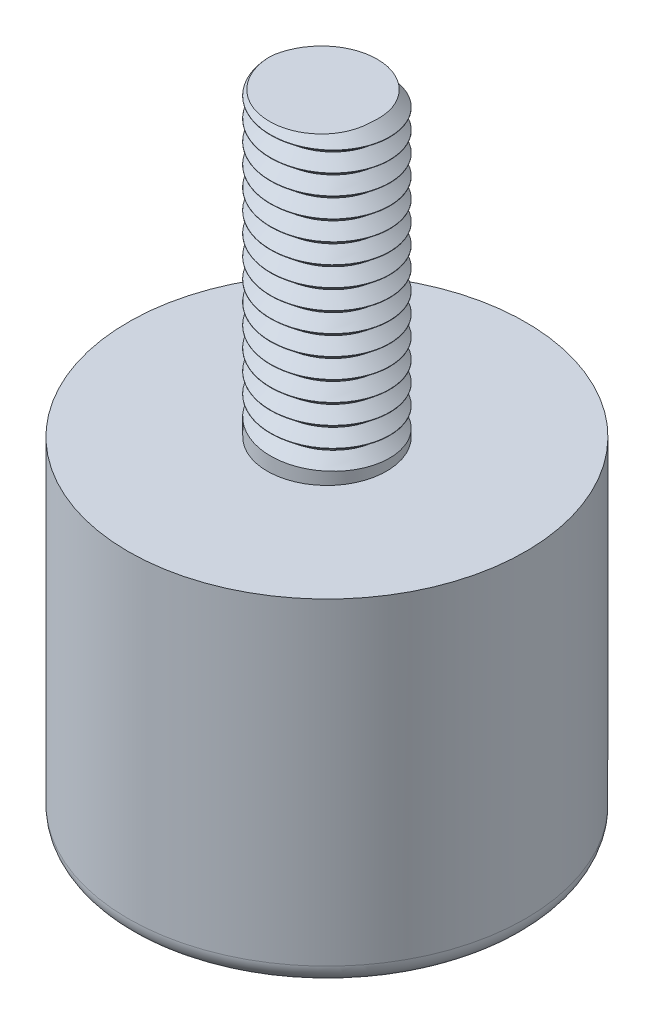
from build123d import *
from build123d.topology import SkipClean

# Parameters (mm, degrees)
ESQUISSE1_R                           = 10
BOSS_EXTRU_1_DEPTH                    = 2
ESQUISSE2_R                           = 10
ESQUISSE2_R_2                         = 8
BOSS_EXTRU_2_DEPTH                    = 15
CONG_1_R                              = 1
ESQUISSE3_R                           = 3
BOSS_EXTRU_3_DEPTH                    = 15
ENL_VEMENT_DE_MATI_RE_BALAYAGE1_PITCH = 1


with BuildPart() as part:
    # Esquisse1 → Boss.-Extru.1 (new body)
    with BuildSketch(Plane(origin=(0, 0, 0), x_dir=(1, 0, 0), z_dir=(0, 1, 0))):
        with Locations(Location((0, 0, 0), (0, 0, 270))):
            Circle(ESQUISSE1_R)
    extrude(amount=-BOSS_EXTRU_1_DEPTH)

    # Esquisse2 → Boss.-Extru.2 (add)
    with BuildSketch(Plane(origin=(0, -2, 0), x_dir=(-1, 0, 0), z_dir=(0, -1, 0))):
        with Locations(Location((0, 0, 0), (0, 0, 270))):
            Circle(ESQUISSE2_R)
        with Locations(Location((0, 0, 0), (0, 0, 90))):
            Circle(ESQUISSE2_R_2, mode=Mode.SUBTRACT)
    extrude(amount=BOSS_EXTRU_2_DEPTH)

    # Congé1
    cong_1_edges = [part.edges().sort_by_distance(p)[0] for p in [
        (0, -17, -10),
    ]]
    fillet(cong_1_edges, radius=CONG_1_R)

    # Esquisse3 → Boss.-Extru.3 (add)
    with BuildSketch(Plane(origin=(0, 0, 0), x_dir=(1, 0, 0), z_dir=(0, 1, 0))):
        with Locations(Location((0, 0, 0), (0, 0, 270))):
            Circle(ESQUISSE3_R)
    extrude(amount=BOSS_EXTRU_3_DEPTH)

    # Enlèvement de matière-Balayage1: the profile of Esquisse5 profile screwed along a left-hand helix of 15 turns, 8 arcs to a turn; built about Z, then put on its axis
    with SkipClean():  # the faces are left unmerged after this step: merging them gives an invalid solid
        enl_vement_de_mati_re_balayage1_z = Axis((0, 0, 0), (0, 0, 1))
        enl_vement_de_mati_re_balayage1_corners = [(3.0003, 0, -0.000245), (2.4, 0, 0.49), (3.0003, 0, 0.980245)]
        with BuildLine(mode=Mode.PRIVATE) as enl_vement_de_mati_re_balayage1_profile:
            Line(enl_vement_de_mati_re_balayage1_corners[0], enl_vement_de_mati_re_balayage1_corners[1])
            Line(enl_vement_de_mati_re_balayage1_corners[1], enl_vement_de_mati_re_balayage1_corners[2])
            Line(enl_vement_de_mati_re_balayage1_corners[2], enl_vement_de_mati_re_balayage1_corners[0])
        enl_vement_de_mati_re_balayage1_cap = Face(enl_vement_de_mati_re_balayage1_profile.wire())
        enl_vement_de_mati_re_balayage1_turn_angles = [0, -22.5, -45, -67.5, -90, -112.5, -135, -157.5, -180, -202.5, -225, -247.5, -270, -292.5, -315, -337.5, -360]
        enl_vement_de_mati_re_balayage1_turn_weights = [1, 0.9238795325112867, 1, 0.9238795325112867, 1, 0.9238795325112867, 1, 0.9238795325112867, 1, 0.9238795325112867, 1, 0.9238795325112867, 1, 0.9238795325112867, 1, 0.9238795325112867, 1]
        enl_vement_de_mati_re_balayage1_turn_rails = [Edge.make_bspline([Vector(p[0], p[1], 0).rotate(enl_vement_de_mati_re_balayage1_z, enl_vement_de_mati_re_balayage1_turn_angles[k]) / enl_vement_de_mati_re_balayage1_turn_weights[k] + Vector(0, 0, p[2] + -ENL_VEMENT_DE_MATI_RE_BALAYAGE1_PITCH * enl_vement_de_mati_re_balayage1_turn_angles[k] / 360) for k in range(17)], [0, 0, 0, 1, 1, 2, 2, 3, 3, 4, 4, 5, 5, 6, 6, 7, 7, 8, 8, 8], 2, enl_vement_de_mati_re_balayage1_turn_weights) for p in enl_vement_de_mati_re_balayage1_corners]
        enl_vement_de_mati_re_balayage1_turn_sides = [Face.make_surface_from_curves(enl_vement_de_mati_re_balayage1_turn_rails[p[0]], enl_vement_de_mati_re_balayage1_turn_rails[p[1]]) for p in [(0, 1), (1, 2), (2, 0)]]
        enl_vement_de_mati_re_balayage1 = Plane(origin=(0, 0, 0), x_dir=(-1, 0, 0), z_dir=(0, 1, 0)) * Solid(Shell([*[p.moved(Location((0, 0, ENL_VEMENT_DE_MATI_RE_BALAYAGE1_PITCH * i))) for i in range(15) for p in enl_vement_de_mati_re_balayage1_turn_sides], enl_vement_de_mati_re_balayage1_cap, enl_vement_de_mati_re_balayage1_cap.rotate(enl_vement_de_mati_re_balayage1_z, -5400).moved(Location((0, 0, -ENL_VEMENT_DE_MATI_RE_BALAYAGE1_PITCH * -5400 / 360)))]))
        add(enl_vement_de_mati_re_balayage1, mode=Mode.SUBTRACT)


solid = part.part
